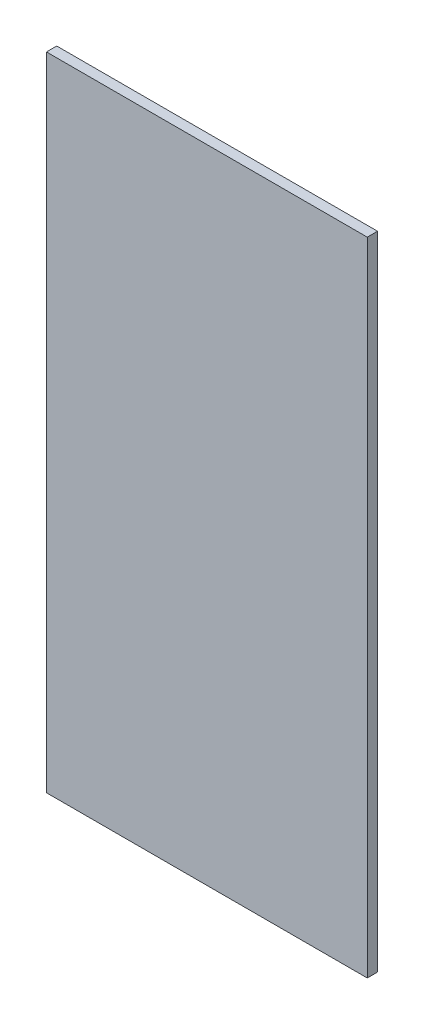
from build123d import *

# Parameters (mm, degrees)
SKETCH1_W           = 50
SKETCH1_H           = 100
BOSS_EXTRUDE1_DEPTH = 1.6


with BuildPart() as part:
    # Sketch1 → Boss-Extrude1 (new body)
    with BuildSketch(Plane.XY):
        with Locations((-2.775981524, -49.972286374)):
            Rectangle(SKETCH1_W, SKETCH1_H)
    extrude(amount=BOSS_EXTRUDE1_DEPTH)


solid = part.part
